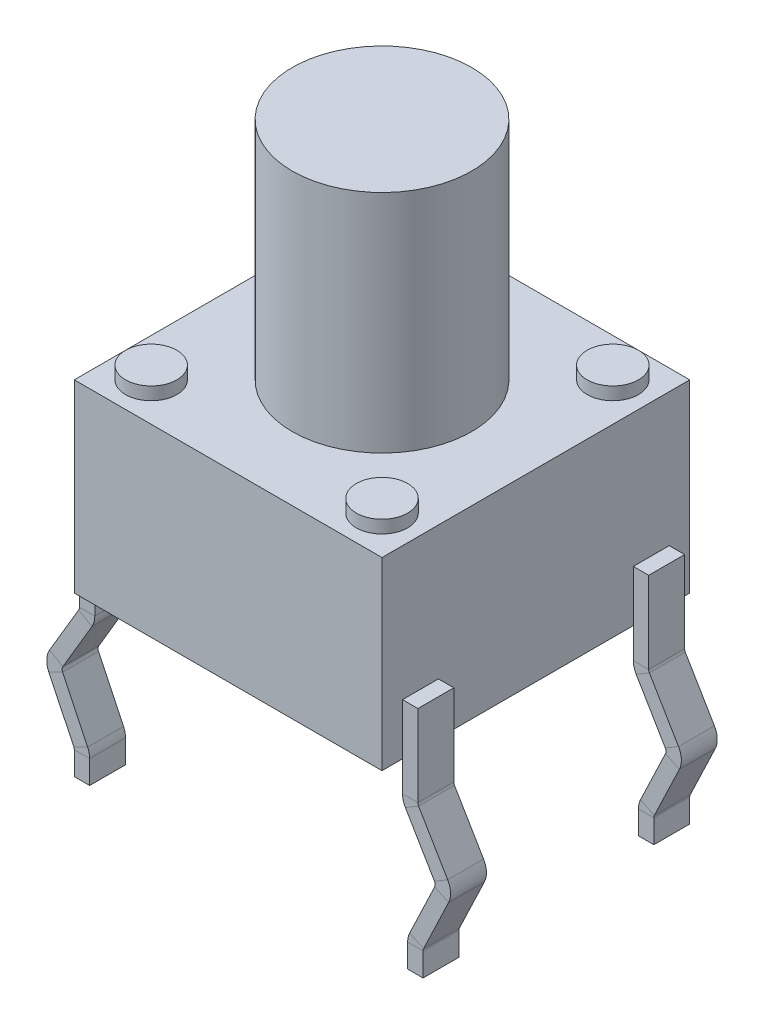
from build123d import *

# Parameters (mm, degrees)
SKETCH1_W            = 6
SKETCH1_H            = 6
BOSS_EXTRUDE1_DEPTH  = 3.6
SKETCH3_R            = 1.75
BOSS_EXTRUDE2_DEPTH  = 4.4
SKETCH4_R            = 0.5
BOSS_EXTRUDE3_DEPTH  = 0.25
LPATTERN1_COUNT      = 2
LPATTERN1_PITCH      = 4.5
LPATTERN1_COUNT_DIR2 = 2
LPATTERN1_PITCH_DIR2 = 4.5
BASE_FLANGE1_DEPTH   = 0.7
BASE_FLANGE2_DEPTH   = 0.7
BASE_FLANGE3_DEPTH   = 0.7
BASE_FLANGE4_DEPTH   = 0.7


# Sheet-metal steps are written as plain solids
with BuildPart() as part:
    # Sketch1 → Boss-Extrude1 (new body)
    with BuildSketch(Plane(origin=(0, 0, 0), x_dir=(1, 0, 0), z_dir=(0, 1, 0))):
        Rectangle(SKETCH1_W, SKETCH1_H)
    extrude(amount=BOSS_EXTRUDE1_DEPTH)

    # Sketch3 → Boss-Extrude2 (add)
    with BuildSketch(Plane(origin=(0, 3.6, 0), x_dir=(1, 0, 0), z_dir=(0, 1, 0))):
        with Locations(Location((0, 0, 0), (0, 0, 270))):
            Circle(SKETCH3_R)
    extrude(amount=BOSS_EXTRUDE2_DEPTH)

    # Sketch4 → Boss-Extrude3 (add)
    with BuildSketch(Plane(origin=(0, 3.6, 0), x_dir=(1, 0, 0), z_dir=(0, 1, 0))):
        with Locations(Location((-2.25, -2.25, 0), (0, 0, 270))):
            Circle(SKETCH4_R)
    boss_extrude3 = extrude(amount=BOSS_EXTRUDE3_DEPTH)

    # LPattern1: Boss-Extrude3 2 × 2
    with Locations(*[(i * LPATTERN1_PITCH, 0, -j * LPATTERN1_PITCH_DIR2) for i in range(LPATTERN1_COUNT) for j in range(LPATTERN1_COUNT_DIR2) if (i, j) != (0, 0)]):
        add(boss_extrude3)


with BuildPart() as body_2:
    # Sketch6 → Base-Flange1 (new body)
    with BuildSketch(Plane.XY.offset(2.6)):
        with BuildLine():
            Line((3, 1), (3, -0.590650318))
            ThreePointArc((3, -0.590650318), (3.014157905, -0.696129594), (3.055629389, -0.794142042))
            Line((3.055629389, -0.794142042), (3.62290698, -1.754150273))
            ThreePointArc((3.62290698, -1.754150273), (3.636715992, -1.800589547), (3.627075137, -1.848069531))
            Line((3.627075137, -1.848069531), (3.138956761, -2.871570572))
            ThreePointArc((3.138956761, -2.871570572), (3.109860733, -2.955487241), (3.1, -3.043755877))
            Line((3.1, -3.043755877), (3.1, -3.5))
            Line((3.1, -3.5), (3.4, -3.5))
            Line((3.4, -3.5), (3.4, -3.043755877))
            ThreePointArc((3.4, -3.043755877), (3.402465183, -3.021688718), (3.40973919, -3.000709551))
            Line((3.40973919, -3.000709551), (3.897857566, -1.97720851))
            ThreePointArc((3.897857566, -1.97720851), (3.936420987, -1.787288575), (3.881184938, -1.60153148))
            Line((3.881184938, -1.60153148), (3.313907347, -0.641523249))
            ThreePointArc((3.313907347, -0.641523249), (3.303539476, -0.617020137), (3.3, -0.590650318))
            Line((3.3, -0.590650318), (3.3, 1))
            Line((3.3, 1), (3, 1))
        make_face()
    extrude(amount=-BASE_FLANGE1_DEPTH)


with BuildPart() as body_3:
    # Sketch9 → Base-Flange2 (new body)
    with BuildSketch(Plane.XY.offset(2.6)):
        with BuildLine():
            Line((-3, 1), (-3, -0.590650318))
            ThreePointArc((-3, -0.590650318), (-3.014157905, -0.696129594), (-3.055629389, -0.794142042))
            Line((-3.055629389, -0.794142042), (-3.62290698, -1.754150273))
            ThreePointArc((-3.62290698, -1.754150273), (-3.636715992, -1.800589547), (-3.627075137, -1.848069531))
            Line((-3.627075137, -1.848069531), (-3.138956761, -2.871570572))
            ThreePointArc((-3.138956761, -2.871570572), (-3.109860733, -2.955487241), (-3.1, -3.043755877))
            Line((-3.1, -3.043755877), (-3.1, -3.5))
            Line((-3.1, -3.5), (-3.4, -3.5))
            Line((-3.4, -3.5), (-3.4, -3.043755877))
            ThreePointArc((-3.4, -3.043755877), (-3.402465183, -3.021688718), (-3.40973919, -3.000709551))
            Line((-3.40973919, -3.000709551), (-3.897857566, -1.97720851))
            ThreePointArc((-3.897857566, -1.97720851), (-3.936420987, -1.787288575), (-3.881184938, -1.60153148))
            Line((-3.881184938, -1.60153148), (-3.313907347, -0.641523249))
            ThreePointArc((-3.313907347, -0.641523249), (-3.303539476, -0.617020137), (-3.3, -0.590650318))
            Line((-3.3, -0.590650318), (-3.3, 1))
            Line((-3.3, 1), (-3, 1))
        make_face()
    extrude(amount=-BASE_FLANGE2_DEPTH)


with BuildPart() as body_4:
    # Sketch12 → Base-Flange3 (new body)
    with BuildSketch(Plane(origin=(0, 0, -2.6), x_dir=(-1, 0, 0), z_dir=(0, 0, -1))):
        with BuildLine():
            Line((-3, 1), (-3, -0.590650318))
            ThreePointArc((-3, -0.590650318), (-3.014157905, -0.696129594), (-3.055629389, -0.794142042))
            Line((-3.055629389, -0.794142042), (-3.62290698, -1.754150273))
            ThreePointArc((-3.62290698, -1.754150273), (-3.636715992, -1.800589547), (-3.627075137, -1.848069531))
            Line((-3.627075137, -1.848069531), (-3.138956761, -2.871570572))
            ThreePointArc((-3.138956761, -2.871570572), (-3.109860733, -2.955487241), (-3.1, -3.043755877))
            Line((-3.1, -3.043755877), (-3.1, -3.5))
            Line((-3.1, -3.5), (-3.4, -3.5))
            Line((-3.4, -3.5), (-3.4, -3.043755877))
            ThreePointArc((-3.4, -3.043755877), (-3.402465183, -3.021688718), (-3.40973919, -3.000709551))
            Line((-3.40973919, -3.000709551), (-3.897857566, -1.97720851))
            ThreePointArc((-3.897857566, -1.97720851), (-3.936420987, -1.787288575), (-3.881184938, -1.60153148))
            Line((-3.881184938, -1.60153148), (-3.313907347, -0.641523249))
            ThreePointArc((-3.313907347, -0.641523249), (-3.303539476, -0.617020137), (-3.3, -0.590650318))
            Line((-3.3, -0.590650318), (-3.3, 1))
            Line((-3.3, 1), (-3, 1))
        make_face()
    extrude(amount=-BASE_FLANGE3_DEPTH)


with BuildPart() as body_5:
    # Sketch15 → Base-Flange4 (new body)
    with BuildSketch(Plane(origin=(0, 0, -2.6), x_dir=(-1, 0, 0), z_dir=(0, 0, -1))):
        with BuildLine():
            Line((3, 1), (3, -0.590650318))
            ThreePointArc((3, -0.590650318), (3.014157905, -0.696129594), (3.055629389, -0.794142042))
            Line((3.055629389, -0.794142042), (3.62290698, -1.754150273))
            ThreePointArc((3.62290698, -1.754150273), (3.636715992, -1.800589547), (3.627075137, -1.848069531))
            Line((3.627075137, -1.848069531), (3.138956761, -2.871570572))
            ThreePointArc((3.138956761, -2.871570572), (3.109860733, -2.955487241), (3.1, -3.043755877))
            Line((3.1, -3.043755877), (3.1, -3.5))
            Line((3.1, -3.5), (3.4, -3.5))
            Line((3.4, -3.5), (3.4, -3.043755877))
            ThreePointArc((3.4, -3.043755877), (3.402465183, -3.021688718), (3.40973919, -3.000709551))
            Line((3.40973919, -3.000709551), (3.897857566, -1.97720851))
            ThreePointArc((3.897857566, -1.97720851), (3.936420987, -1.787288575), (3.881184938, -1.60153148))
            Line((3.881184938, -1.60153148), (3.313907347, -0.641523249))
            ThreePointArc((3.313907347, -0.641523249), (3.303539476, -0.617020137), (3.3, -0.590650318))
            Line((3.3, -0.590650318), (3.3, 1))
            Line((3.3, 1), (3, 1))
        make_face()
    extrude(amount=-BASE_FLANGE4_DEPTH)


solid = Compound([part.part, body_2.part, body_3.part, body_4.part, body_5.part])
